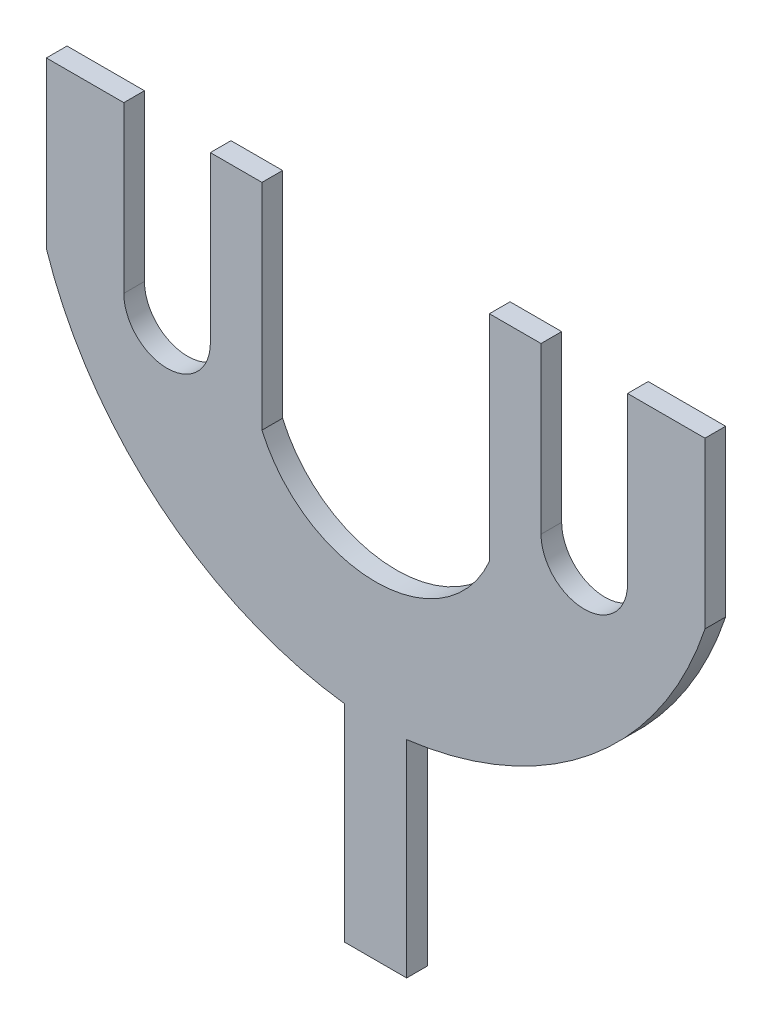
from build123d import *

# Parameters (mm, degrees)
BOSS_EXTRUDE2_DEPTH = 1


with BuildPart() as part:
    # Sketch2 → Boss-Extrude2 (new body)
    with BuildSketch(Plane.XY):
        with BuildLine():
            Line((-20.895029961, 21.487770019), (-17.145029961, 21.487770019))
            Line((-17.145029961, 21.487770019), (-17.145029961, 13.487770019))
            ThreePointArc((-17.145029961, 13.487770019), (-15.050029961, 11.392770019), (-12.955029961, 13.487770019))
            Line((-12.955029961, 13.487770019), (-12.955029961, 21.487770019))
            Line((-12.955029961, 21.487770019), (-10.455029961, 21.487770019))
            Line((-10.455029961, 21.487770019), (-10.455029961, 11.095395606))
            ThreePointArc((-10.455029961, 11.095395606), (-4.947514981, 7.483090461), (0.56, 11.095395606))
            Line((0.56, 11.095395606), (0.56, 21.487770019))
            Line((0.56, 21.487770019), (3.06, 21.487770019))
            Line((3.06, 21.487770019), (3.06, 13.487770019))
            ThreePointArc((3.06, 13.487770019), (5.155, 11.392770019), (7.25, 13.487770019))
            Line((7.25, 13.487770019), (7.25, 21.487770019))
            Line((7.25, 21.487770019), (11, 21.487770019))
            Line((11, 21.487770019), (11, 13.487770019))
            ThreePointArc((11, 13.487770019), (5.4935016, 5.464082673), (-3.447514981, 1.622298483))
            Line((-3.447514981, 1.622298483), (-3.447514981, -8.377701517))
            Line((-3.447514981, -8.377701517), (-6.447514981, -8.377701517))
            Line((-6.447514981, -8.377701517), (-6.447514981, 1.622298483))
            ThreePointArc((-6.447514981, 1.622298483), (-15.388531561, 5.464082673), (-20.895029961, 13.487770019))
            Line((-20.895029961, 13.487770019), (-20.895029961, 21.487770019))
        make_face()
    extrude(amount=BOSS_EXTRUDE2_DEPTH)


solid = part.part
